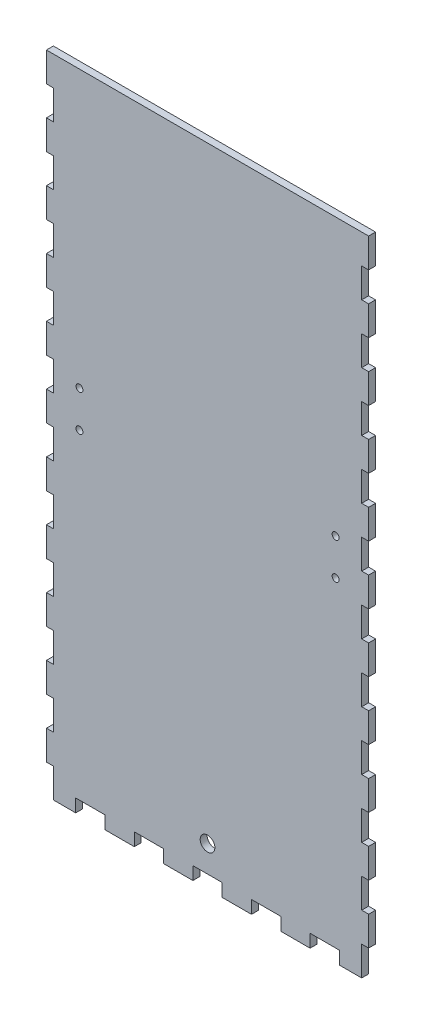
from build123d import *

# Parameters (mm, degrees)
BOSS_EXTRUDE1_DEPTH = 2.9972
SKETCH2_R           = 3.175
CUT_EXTRUDE1_DEPTH  = 283.553021581
SKETCH3_R           = 1.5
CUT_EXTRUDE2_DEPTH  = 283.553021581


with BuildPart() as part:
    # Sketch1 → Boss-Extrude1 (new body)
    with BuildSketch(Plane.XY):
        Polygon((-69.6722, 273.812), (-69.6722, 261.112), (-66.675, 261.112), (-66.675, 248.412), (-69.6722, 248.412), (-69.6722, 235.712), (-66.675, 235.712), (-66.675, 223.012), (-69.6722, 223.012), (-69.6722, 210.312), (-66.675, 210.312), (-66.675, 197.612), (-69.6722, 197.612), (-69.6722, 184.912), (-66.675, 184.912), (-66.675, 172.212), (-69.6722, 172.212), (-69.6722, 159.512), (-66.675, 159.512), (-66.675, 146.812), (-69.6722, 146.812), (-69.6722, 134.112), (-66.675, 134.112), (-66.675, 121.412), (-69.6722, 121.412), (-69.6722, 108.712), (-66.675, 108.712), (-66.675, 96.012), (-69.6722, 96.012), (-69.6722, 83.312), (-66.675, 83.312), (-66.675, 70.612), (-69.6722, 70.612), (-69.6722, 57.912), (-66.675, 57.912), (-66.675, 45.212), (-69.6722, 45.212), (-69.6722, 32.512), (-66.675, 32.512), (-66.675, 19.812), (-69.6722, 19.812), (-69.6722, 7.112), (-66.675, 7.112), (-66.675, -5.588), (-57.004527273, -5.588), (-57.004527273, 0), (-44.336854545, 0), (-44.336854545, -5.588), (-31.669181818, -5.588), (-31.669181818, 0), (-19.001509091, 0), (-19.001509091, -5.588), (-6.333836364, -5.588), (-6.333836364, 0), (6.333836364, 0), (6.333836364, -5.588), (19.001509091, -5.588), (19.001509091, 0), (31.669181818, 0), (31.669181818, -5.588), (44.336854545, -5.588), (44.336854545, 0), (57.004527273, 0), (57.004527273, -5.588), (66.675, -5.588), (66.675, 7.112), (69.6722, 7.112), (69.6722, 19.812), (66.675, 19.812), (66.675, 32.512), (69.6722, 32.512), (69.6722, 45.212), (66.675, 45.212), (66.675, 57.912), (69.6722, 57.912), (69.6722, 70.612), (66.675, 70.612), (66.675, 83.312), (69.6722, 83.312), (69.6722, 96.012), (66.675, 96.012), (66.675, 108.712), (69.6722, 108.712), (69.6722, 121.412), (66.675, 121.412), (66.675, 134.112), (69.6722, 134.112), (69.6722, 146.812), (66.675, 146.812), (66.675, 159.512), (69.6722, 159.512), (69.6722, 172.212), (66.675, 172.212), (66.675, 184.912), (69.6722, 184.912), (69.6722, 197.612), (66.675, 197.612), (66.675, 210.312), (69.6722, 210.312), (69.6722, 223.012), (66.675, 223.012), (66.675, 235.712), (69.6722, 235.712), (69.6722, 248.412), (66.675, 248.412), (66.675, 261.112), (69.6722, 261.112), (69.6722, 273.812), align=None)
    extrude(amount=BOSS_EXTRUDE1_DEPTH)

    # Sketch2 → Cut-Extrude1 (cut, through all)
    with BuildSketch(Plane.XY.offset(2.9972)):
        with Locations((0, 11.43)):
            Circle(SKETCH2_R)
    extrude(amount=-CUT_EXTRUDE1_DEPTH, mode=Mode.SUBTRACT)

    # Sketch3 → Cut-Extrude2 (cut, through all)
    with BuildSketch(Plane.XY.offset(2.9972)):
        with Locations((-55.3847, 154.305)):
            Circle(SKETCH3_R)
        with Locations((-55.3847, 138.557)):
            Circle(SKETCH3_R)
        with Locations((55.3847, 154.305)):
            Circle(SKETCH3_R)
        with Locations((55.3847, 138.557)):
            Circle(SKETCH3_R)
    extrude(amount=-CUT_EXTRUDE2_DEPTH, mode=Mode.SUBTRACT)


solid = part.part
